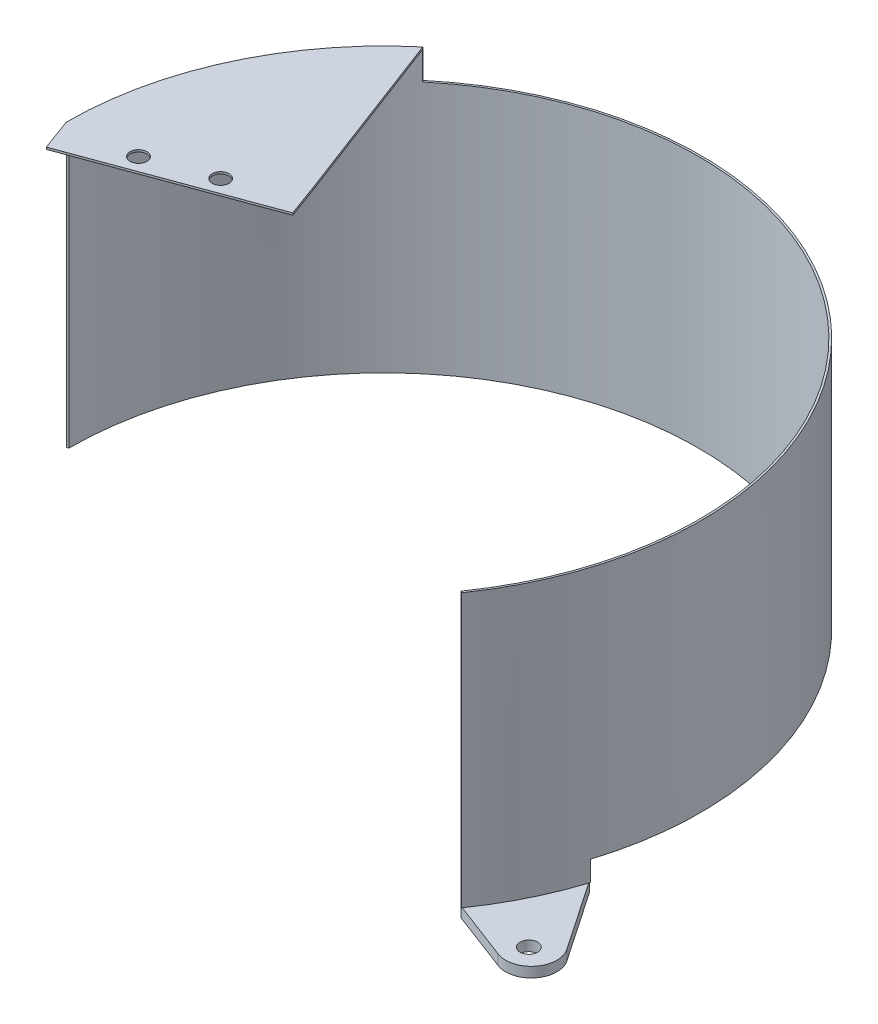
from build123d import *
from build123d.topology import SkipClean

# Parameters (mm, degrees)
BASE_FLANGE1_DEPTH  = 102.87
CUT_EXTRUDE1_START  = -7.62
CUT_EXTRUDE1_DEPTH  = 7.62
BOSS_EXTRUDE5_START = -95.25
BOSS_EXTRUDE5_DEPTH = 95.25
BOSS_EXTRUDE6_DEPTH = 10.16
BOSS_EXTRUDE7_DEPTH = 0.762
SKETCH12_W          = 72.378245623
SKETCH12_H          = 0.762
BOSS_EXTRUDE8_DEPTH = 12.7
SKETCH13_R          = 3.175
CUT_EXTRUDE2_DEPTH  = 204.597121983
BOSS_EXTRUDE9_START = 3.81
BOSS_EXTRUDE9_DEPTH = 3.81


# Read off the part's stored shape, not the designer's step: Cut-Extrude1
# Sheet-metal steps are written as plain solids
with BuildPart() as part:
    # Sketch2 → Base-Flange1 (new body)
    with BuildSketch(Plane(origin=(0, 0, 0), x_dir=(1, 0, 0), z_dir=(0, 1, 0))):
        with BuildLine():
            ThreePointArc((-119.38, 0), (35.898258345, 113.85472958), (97.790371047, -68.473554972))
            Line((97.790371047, -68.473554972), (97.186983651, -68.051058569))
            ThreePointArc((97.186983651, -68.051058569), (35.676758453, 113.152221674), (-118.6434, 0))
            Line((-118.6434, 0), (-119.38, 0))
        make_face()
    extrude(amount=BASE_FLANGE1_DEPTH)

    # Cut-Extrude1 outline → Cut-Extrude1 (cut)
    with BuildSketch(Plane.XZ.offset(CUT_EXTRUDE1_START)):
        with BuildLine():
            ThreePointArc((-119.38, 0), (18.160489843, -117.990597119), (113.85472958, 35.898258345))
            Line((113.85472958, 35.898258345), (113.152221674, 35.676758453))
            ThreePointArc((113.152221674, 35.676758453), (18.048435757, -117.262570031), (-118.6434, 0))
            Line((-118.6434, 0), (-119.38, 0))
        make_face()
    extrude(amount=CUT_EXTRUDE1_DEPTH, mode=Mode.SUBTRACT)

    # Sketch9 → Boss-Extrude5 (add)
    with BuildSketch(Plane(origin=(0, 102.87, 0), x_dir=(1, 0, 0), z_dir=(0, 1, 0)).offset(BOSS_EXTRUDE5_START)):
        with BuildLine():
            Line((-119.379693576, -0.270484204), (-118.6434, 0))
            Line((-118.6434, 0), (-119.38, 0))
            ThreePointArc((-119.38, 0), (-119.379923394, -0.135242189), (-119.379693576, -0.270484204))
        make_face()
    extrude(amount=BOSS_EXTRUDE5_DEPTH)

    # Sketch10 → Boss-Extrude6 (add)
    with SkipClean():  # the faces are left unmerged after this step: merging them gives an invalid solid
        with BuildSketch(Plane(origin=(0, 102.87, 0), x_dir=(1, 0, 0), z_dir=(0, 1, 0))):
            with BuildLine():
                Line((-119.379693576, -0.270484204), (-118.6434, 0))
                ThreePointArc((-118.6434, 0), (-107.527437301, 50.140867475), (-76.262507491, 90.886117283))
                Line((-76.262507491, 90.886117283), (-76.735984844, 91.45038562))
                ThreePointArc((-76.735984844, 91.45038562), (-108.252110006, 50.329564663), (-119.379693576, -0.270484204))
            make_face()
        extrude(amount=BOSS_EXTRUDE6_DEPTH)

    # Sketch11 → Boss-Extrude7 (add)
    with SkipClean():  # the faces are left unmerged after this step: merging them gives an invalid solid
        with BuildSketch(Plane(origin=(0, 113.03, 0), x_dir=(1, 0, 0), z_dir=(0, 1, 0))):
            with BuildLine():
                Line((-119.379693576, -0.270484204), (-51.440692331, 24.687531528))
                Line((-51.440692331, 24.687531528), (-76.735984844, 91.45038562))
                ThreePointArc((-76.735984844, 91.45038562), (-108.252110006, 50.329564663), (-119.379693576, -0.270484204))
            make_face()
        extrude(amount=BOSS_EXTRUDE7_DEPTH)

    # Sketch12 → Boss-Extrude8 (add)
    with SkipClean():  # the faces are left unmerged after this step: merging them gives an invalid solid
        with BuildSketch(Plane(origin=(-14.107419738, 0, -38.402251904), x_dir=(0.9386660406079884, 0, -0.3448275862069655), z_dir=(0.3448275862069655, 0, 0.9386660406079884))):
            with Locations((-75.961811901, 113.411)):
                Rectangle(SKETCH12_W, SKETCH12_H)
        extrude(amount=BOSS_EXTRUDE8_DEPTH)

    # Sketch13 → Cut-Extrude2 (cut, through all)
    with SkipClean():  # the faces are left unmerged after this step: merging them gives an invalid solid
        with BuildSketch(Plane(origin=(0, 113.792, 0), x_dir=(1, 0, 0), z_dir=(0, 1, 0))):
            with Locations(Location((-94.540026844, 2.089676094, 0), (0, 0, 270))):
                Circle(SKETCH13_R)
            with Locations(Location((-71.890015284, 10.410365749, 0), (0, 0, 270))):
                Circle(SKETCH13_R)
        extrude(amount=-CUT_EXTRUDE2_DEPTH, mode=Mode.SUBTRACT)

    # Sketch14 → Boss-Extrude9 (add)
    with SkipClean():  # the faces are left unmerged after this step: merging them gives an invalid solid
        with BuildSketch(Plane.XZ.offset(BOSS_EXTRUDE9_START)):
            with BuildLine():
                Line((97.186983651, 68.051058569), (119.774310511, 76.632245246))
                ThreePointArc((119.774310511, 76.632245246), (130.778139327, 73.589906503), (131.18256886, 62.180414385))
                Line((131.18256886, 62.180414385), (113.152221674, 35.676758453))
                ThreePointArc((113.152221674, 35.676758453), (106.408031423, 52.474633989), (97.186983651, 68.051058569))
            make_face()
            with BuildLine():
                ThreePointArc((126.590987662, 68.955600398), (122.972686098, 71.90312373), (120.025162766, 68.284822166))
                ThreePointArc((120.025162766, 68.284822166), (123.64346433, 65.337298834), (126.590987662, 68.955600398))
            make_face(mode=Mode.SUBTRACT)
        extrude(amount=-BOSS_EXTRUDE9_DEPTH)


solid = part.part
